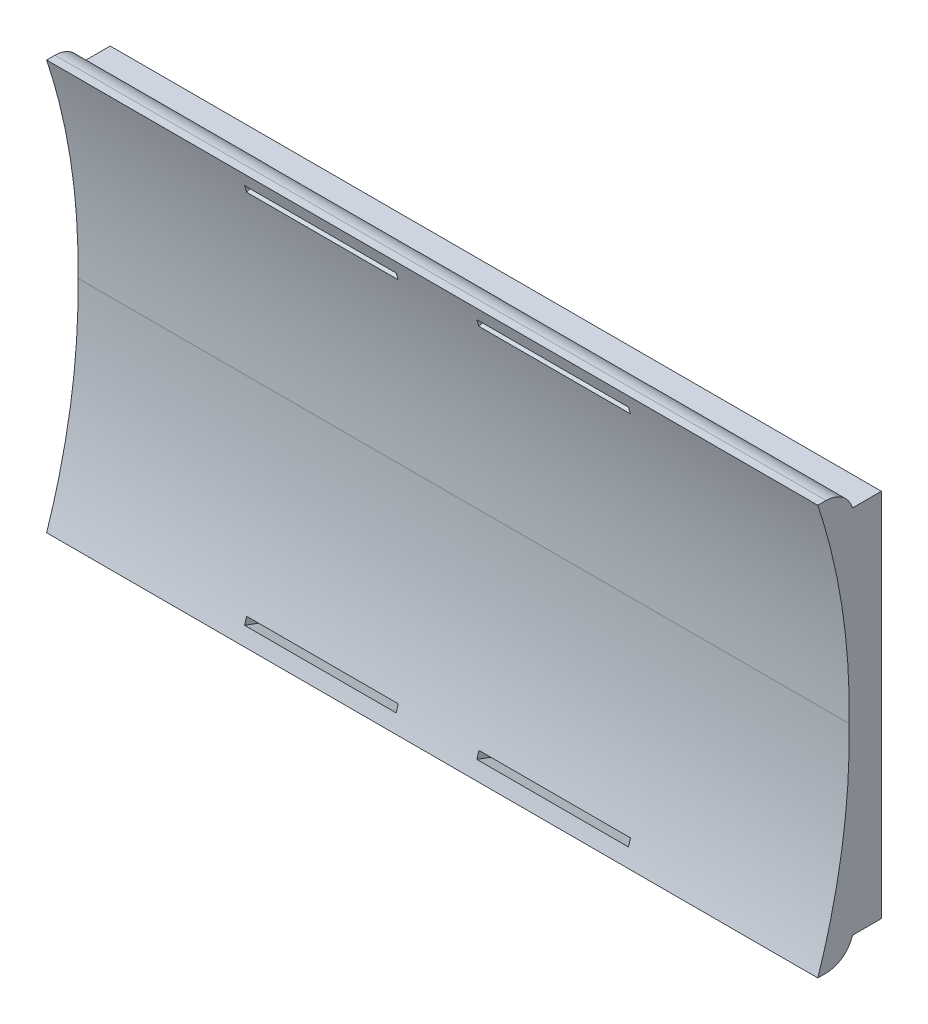
from build123d import *

# Parameters (mm, degrees)
BOSS_EXTRUDE1_DEPTH = 3
SKETCH2_W           = 111.9
SKETCH2_H           = 53.7
BOSS_EXTRUDE2_DEPTH = 1.2
BOSS_EXTRUDE3_DEPTH = 111.9
SKETCH4_W           = 22
SKETCH4_H           = 1.035820464
CUT_EXTRUDE1_DEPTH  = 20
FILLET1_R           = 4
SKETCH5_W           = 25
SKETCH5_H           = 1.236157198
CUT_EXTRUDE2_DEPTH  = 3


with BuildPart() as part:
    # Sketch1 → Boss-Extrude1 (new body)
    with BuildSketch(Plane.XY):
        Polygon((-55.95, 25.65), (-54.75, 25.65), (54.75, 25.65), (54.75, -25.65), (-54.75, -25.65), (-55.95, -25.65), (-55.95, -26.85), (55.95, -26.85), (55.95, 26.85), (-55.95, 26.85), align=None)
    extrude(amount=BOSS_EXTRUDE1_DEPTH)

    # Sketch2 → Boss-Extrude2 (add)
    with BuildSketch(Plane.XY.offset(3)):
        Rectangle(SKETCH2_W, SKETCH2_H)
    extrude(amount=BOSS_EXTRUDE2_DEPTH)

    # Sketch3 → Boss-Extrude3 (add)
    with BuildSketch(Plane(origin=(55.95, 0, 0), x_dir=(0, 0, -1), z_dir=(1, 0, 0))):
        with BuildLine():
            Line((-4.2, -26.886157198), (-5.225151607, -29.702738088))
            Line((-5.225151607, -29.702738088), (-9.225151607, -29.702738088))
            add(Edge.make_bspline(
                [(-4.671449622, 0), (-4.439281188, -15.258416184), (-9.225151607, -29.702738088)],
                knots=[0, 0, 0, 1, 1, 1], degree=2))
            add(Edge.make_bspline(
                [(-4.671449622, 0), (-4.439281188, 15.258416184), (-9.225151607, 29.702738088)],
                knots=[0, 0, 0, 1, 1, 1], degree=2))
            Line((-9.225151607, 29.702738088), (-5.225151607, 29.702738088))
            Line((-5.225151607, 29.702738088), (-4.2, 26.886157198))
            Line((-4.2, 26.886157198), (-4.2, -26.886157198))
        make_face()
    extrude(amount=-BOSS_EXTRUDE3_DEPTH)

    # Sketch4 → Cut-Extrude1 (cut)
    with BuildSketch(Plane(origin=(0, 1.795228959, -4.932351029), x_dir=(-1, 0, 0), z_dir=(0, 0.3420201433256726, -0.939692620785907))):
        with Locations((-16.815363001, 28.380640668)):
            Rectangle(SKETCH4_W, SKETCH4_H)
        with Locations((16.884636999, 28.380640668)):
            Rectangle(SKETCH4_W, SKETCH4_H)
    cut_extrude1 = extrude(amount=-CUT_EXTRUDE1_DEPTH, mode=Mode.SUBTRACT)

    # Mirror1: Cut-Extrude1 across plane
    add(cut_extrude1.mirror(Plane.ZX), mode=Mode.SUBTRACT)

    # Fillet1
    # the kernel refuses this fillet: 4 mm, written as the material it takes off along each edge
    with BuildSketch(Plane(origin=(62.952075382, 29.702738088, 5.225151607), x_dir=(0, 0, 1), z_dir=(-1, 0, 0)), Plane(origin=(62.952075382, -29.702738088, 5.225151607), x_dir=(0, 0.9396926207859048, -0.34202014332567854), z_dir=(-1, 0, 0))) as fillet1_piece_1:
        with BuildLine():
            CenterArc((FILLET1_R * 0.70020753821, -FILLET1_R), FILLET1_R, 90, 70)
            Line((-FILLET1_R * 0.239485082576, -FILLET1_R * 0.657979856674), (0, 0))
            Line((0, 0), (FILLET1_R * 0.70020753821, 0))
        make_face()
    extrude(amount=125.904150764, mode=Mode.SUBTRACT)

    # Sketch5 → Cut-Extrude2 (cut)
    with BuildSketch(Plane(origin=(0, 0, 0), x_dir=(-1, 0, 0), z_dir=(0, 0, -1))):
        with Locations((43.45, -26.268078599)):
            Rectangle(SKETCH5_W, SKETCH5_H)
    extrude(amount=-CUT_EXTRUDE2_DEPTH, mode=Mode.SUBTRACT)


solid = part.part
